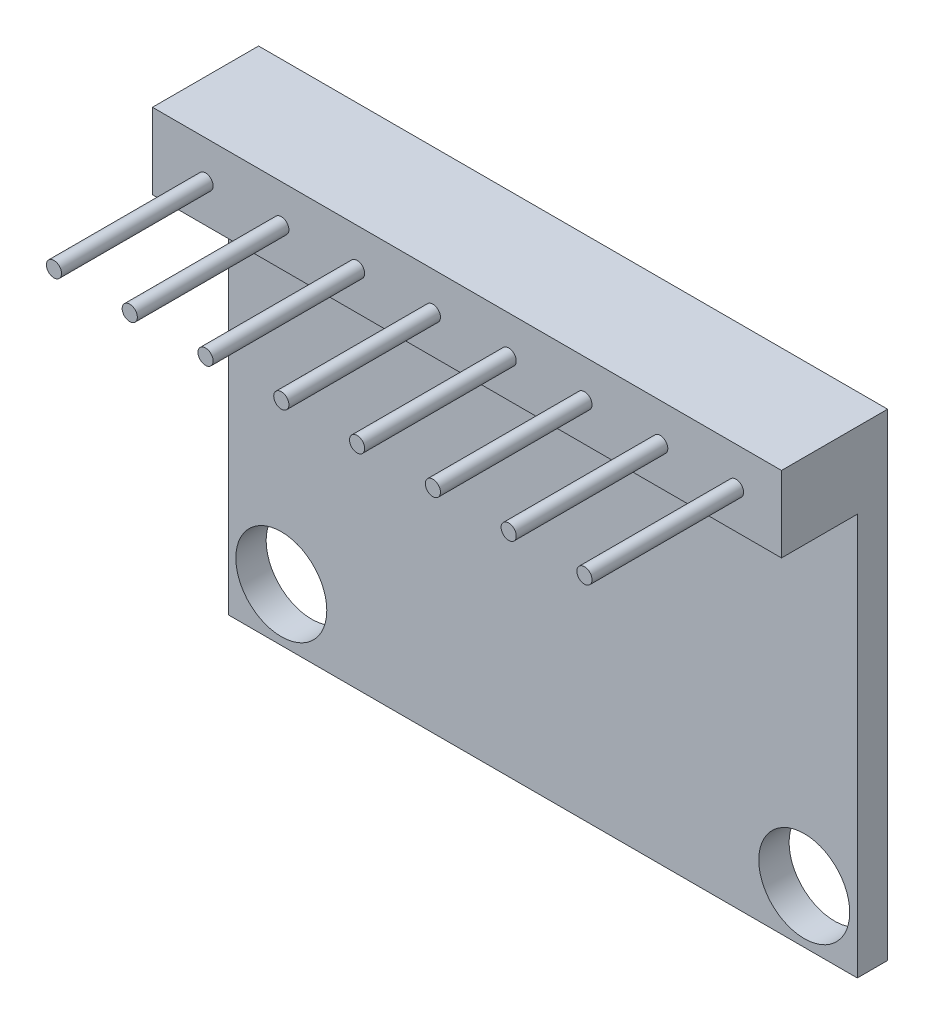
from build123d import *

# Parameters (mm, degrees)
ESQUISSE1_W             = 20.75
ESQUISSE1_H             = 15.75
BOSS_EXTRU_1_DEPTH      = 1
ESQUISSE2_W             = 20.75
ESQUISSE2_H             = 2.5
BOSS_EXTRU_2_DEPTH      = 2.5
BOSS_EXTRU_3_DEPTH      = 5
BOSS_EXTRU_3_DEPTH_BACK = 4
ESQUISSE3_R             = 0.25
ESQUISSE4_W             = 0.5
ESQUISSE4_H             = 2
ESQUISSE4_H_2           = 1
ESQUISSE4_W_2           = 4
ESQUISSE4_H_3           = 4
ESQUISSE4_W_3           = 2.5
BOSS_EXTRU_4_DEPTH      = 0.5
ESQUISSE5_R             = 1.5
ENL_V_MAT_EXTRU_1_DEPTH = 5
ESQUISSE6_W             = 2.5
ESQUISSE6_H             = 2
BOSS_EXTRU_5_DEPTH      = 0.5


with BuildPart() as part:
    # Esquisse1 → Boss.-Extru.1 (new body)
    with BuildSketch(Plane.XY):
        with Locations((-10.375, 7.875)):
            Rectangle(ESQUISSE1_W, ESQUISSE1_H)
    extrude(amount=BOSS_EXTRU_1_DEPTH)

    # Esquisse2 → Boss.-Extru.2 (add)
    with BuildSketch(Plane.XY.offset(1)):
        with Locations((-10.375, 14.5)):
            Rectangle(ESQUISSE2_W, ESQUISSE2_H)
    extrude(amount=BOSS_EXTRU_2_DEPTH)

    # Esquisse3 → Boss.-Extru.3 (add, two sides: drawn at the far end of the back side and taken through both)
    with BuildSketch(Plane.XY.offset(3.5).offset(-BOSS_EXTRU_3_DEPTH_BACK)):
        with Locations((-19, 14.5)):
            Circle(ESQUISSE3_R)
        with Locations((-16.5, 14.5)):
            Circle(ESQUISSE3_R)
        with Locations((-14, 14.5)):
            Circle(ESQUISSE3_R)
        with Locations((-11.5, 14.5)):
            Circle(ESQUISSE3_R)
        with Locations((-9, 14.5)):
            Circle(ESQUISSE3_R)
        with Locations((-6.5, 14.5)):
            Circle(ESQUISSE3_R)
        with Locations((-4, 14.5)):
            Circle(ESQUISSE3_R)
        with Locations((-1.5, 14.5)):
            Circle(ESQUISSE3_R)
    extrude(amount=BOSS_EXTRU_3_DEPTH + BOSS_EXTRU_3_DEPTH_BACK)

    # Esquisse4 → Boss.-Extru.4 (add)
    with BuildSketch(Plane(origin=(0, 0, 0), x_dir=(-1, 0, 0), z_dir=(0, 0, -1))):
        with Locations((4.625, 8.875)):
            Rectangle(ESQUISSE4_W, ESQUISSE4_H)
        with Locations((5.625, 9.375)):
            Rectangle(ESQUISSE4_W, ESQUISSE4_H_2)
        with Locations((6.625, 8.875)):
            Rectangle(ESQUISSE4_W, ESQUISSE4_H)
        with Locations((14.125, 8.875)):
            Rectangle(ESQUISSE4_W, ESQUISSE4_H)
        with Locations((15.125, 9.375)):
            Rectangle(ESQUISSE4_W, ESQUISSE4_H_2)
        with Locations((16.125, 8.875)):
            Rectangle(ESQUISSE4_W, ESQUISSE4_H)
        with Locations((10.375, 7.875)):
            Rectangle(ESQUISSE4_W_2, ESQUISSE4_H_3)
        with Locations((4.625, 6.375)):
            Rectangle(ESQUISSE4_W, ESQUISSE4_H_2)
        with Locations((6.625, 5.875)):
            Rectangle(ESQUISSE4_W, ESQUISSE4_H)
        with Locations((10.00670855, 3.574144423)):
            Rectangle(ESQUISSE4_W_3, ESQUISSE4_H_2)
        with Locations((14.125, 6.375)):
            Rectangle(ESQUISSE4_W, ESQUISSE4_H_2)
        with Locations((16.125, 5.875)):
            Rectangle(ESQUISSE4_W, ESQUISSE4_H)
    extrude(amount=BOSS_EXTRU_4_DEPTH)

    # Esquisse5 → Enlèv. mat.-Extru.1 (cut)
    with BuildSketch(Plane(origin=(0, 0, 0), x_dir=(-1, 0, 0), z_dir=(0, 0, -1))):
        with Locations((1.75, 1.75)):
            Circle(ESQUISSE5_R)
        with Locations((19, 1.75)):
            Circle(ESQUISSE5_R)
    extrude(amount=-ENL_V_MAT_EXTRU_1_DEPTH, mode=Mode.SUBTRACT)

    # Esquisse6 → Boss.-Extru.5 (add)
    with BuildSketch(Plane(origin=(0, 0, 0), x_dir=(-1, 0, 0), z_dir=(0, 0, -1))):
        with Locations((19, 8.875)):
            Rectangle(ESQUISSE6_W, ESQUISSE6_H)
    extrude(amount=BOSS_EXTRU_5_DEPTH)


solid = part.part
